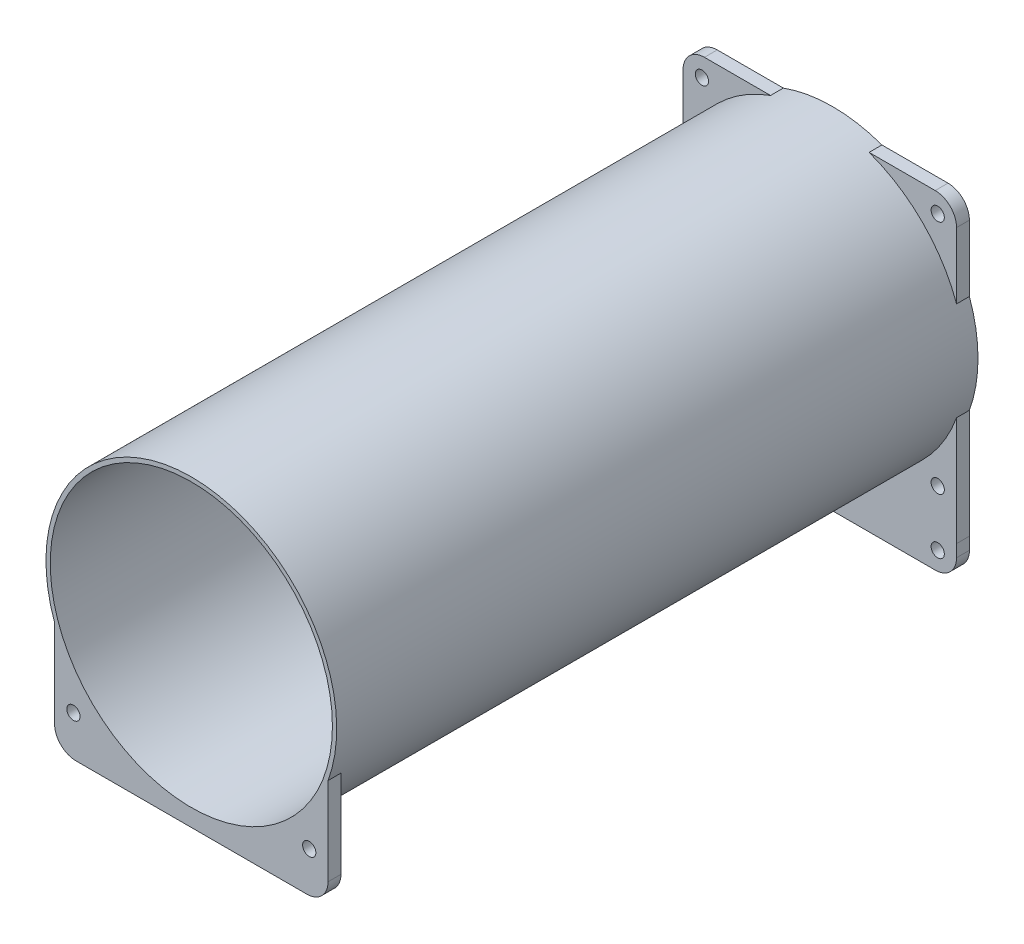
from build123d import *

# Parameters (mm, degrees)
SKETCH_2_R            = 1.5499999999999978
SKETCH_2_R_2          = 1.5500000000187404
SKETCH_2_R_3          = 33.000000000018005
SKETCH_2_R_4          = 1.5500000000180028
EXTRUDE_1_DEPTH       = 3
EXTRUDE_START         = 3
EXTRUDE_2_OUTLINE_R   = 34
EXTRUDE_2_OUTLINE_R_2 = 33
EXTRUDE_2_DEPTH       = 147
EXTRUDE_START_2       = -3
SKETCH_5_R            = 1.5499999999999978
SKETCH_5_R_2          = 1.5500000000187402
EXTRUDE_3_DEPTH       = 3


# Read off the part's stored shape, not the designer's step: 凸台-拉伸2
with BuildPart() as part:
    # 草图2 → 凸台-拉伸1 (new body)
    with BuildSketch(Plane.XY.offset(50)):
        with BuildLine():
            Line((-31.98646774923986, 34.973103667177796), (-31.986467749238788, 9.470000000000049))
            Line((-31.986467749238788, 9.47000000000005), (-31.99138785319973, 6.608597351179577))
            ThreePointArc((-31.99138785319973, 6.608597351179577), (-30.529967467729293, 3.0675070244866425), (-26.991395244649887, 1.5999999999999854))
            Line((-26.991395244649887, 1.5999999999999854), (26.99139524464973, 1.6000000000000048))
            ThreePointArc((26.99139524464973, 1.600000000000005), (30.529967467729193, 3.067507024486723), (31.99138785319957, 6.6085973511797595))
            Line((31.99138785319957, 6.6085973511797595), (31.98646774923853, 9.470000000001768))
            Line((31.98646774923853, 9.470000000001768), (31.986467749238717, 34.9731036671784))
            ThreePointArc((31.986467749239328, 34.97310366717818), (34.000000000018005, 46.499849995960744), (31.986467749239164, 58.026596324743274))
            Line((31.986467749238994, 58.02659632474322), (31.98646774923853, 73.4863177451979))
            ThreePointArc((31.986467749238525, 73.4863177451979), (30.52200165517117, 77.02185165113154), (26.986467749237562, 78.486317745199))
            Line((26.986467749237562, 78.486317745199), (11.526746328783656, 78.48631774519934))
            ThreePointArc((11.526746328783661, 78.48631774519934), (1.3678e-13, 80.49984999597851), (-11.5267463287834, 78.48631774519944))
            Line((-11.526746328783396, 78.48631774519944), (-26.98646774923796, 78.48631774520034))
            ThreePointArc((-26.98646774923796, 78.48631774520034), (-30.52200165517142, 77.02185165113266), (-31.98646774923918, 73.48631774519924))
            Line((-31.986467749239182, 73.48631774519924), (-31.986467749239175, 58.02659632474571))
            ThreePointArc((-31.986467749239328, 58.026596324742826), (-34.000000000018005, 46.4998499959604), (-31.986467749239267, 34.973103667178016))
        make_face()
        with Locations((-27.577164466275363, 5.922685529685147)):
            Circle(SKETCH_2_R, mode=Mode.SUBTRACT)
        with Locations((-27.577164466275352, 18.922685529685147)):
            Circle(SKETCH_2_R_2, mode=Mode.SUBTRACT)
        with Locations((27.57716446627534, 5.92268552968515)):
            Circle(SKETCH_2_R, mode=Mode.SUBTRACT)
        with Locations((27.577164466275352, 18.922685529685147)):
            Circle(SKETCH_2_R_2, mode=Mode.SUBTRACT)
        with Locations((0, 46.4998499959605)):
            Circle(SKETCH_2_R_3, mode=Mode.SUBTRACT)
        with Locations((-27.577164466275352, 74.07701446223585)):
            Circle(SKETCH_2_R_4, mode=Mode.SUBTRACT)
        with Locations((27.577164466275352, 74.07701446223585)):
            Circle(SKETCH_2_R_4, mode=Mode.SUBTRACT)
    extrude(amount=EXTRUDE_1_DEPTH)

    # 凸台-拉伸2 outline → 凸台-拉伸2 (add)
    with BuildSketch(Plane.XY.offset(50).offset(EXTRUDE_START)):
        with Locations((0, 46.499849996)):
            Circle(EXTRUDE_2_OUTLINE_R)
        with Locations((0, 46.499849996)):
            Circle(EXTRUDE_2_OUTLINE_R_2, mode=Mode.SUBTRACT)
    extrude(amount=EXTRUDE_2_DEPTH)

    # 草图5 → 凸台-拉伸3 (add)
    # profile 1 of 3: a face of its own
    with BuildSketch(Plane.XY.offset(200).offset(EXTRUDE_START_2)):
        with Locations((27.57716446627534, 5.92268552968515)):
            Circle(SKETCH_5_R)
    # profile 2 of 3: a face of its own
    with BuildSketch(Plane.XY.offset(200).offset(EXTRUDE_START_2)):
        with Locations((-27.577164466275363, 5.922685529685147)):
            Circle(SKETCH_5_R)
    # profile 3 of 3: a face of its own
    with BuildSketch(Plane.XY.offset(200).offset(EXTRUDE_START_2)):
        with BuildLine():
            Line((31.986467749238557, 14.470000000001733), (31.986467749238717, 34.9731036671784))
            ThreePointArc((31.986467749238717, 34.9731036671784), (6.9664e-13, 12.499849995942498), (-31.98646774923986, 34.973103667177796))
            Line((-31.98646774923986, 34.973103667177796), (-31.986467749238994, 14.470000000001559))
            ThreePointArc((-31.986467749238994, 14.470000000001559), (-30.522001655171657, 10.934466094068965), (-26.986467749239004, 9.470000000001766))
            Line((-26.986467749239004, 9.470000000001766), (26.986467749238557, 9.470000000001766))
            ThreePointArc((26.986467749238557, 9.470000000001766), (30.52200165517128, 10.93446609406902), (31.986467749238557, 14.470000000001733))
        make_face()
        with Locations((27.577164466275352, 18.922685529685147)):
            Circle(SKETCH_5_R_2, mode=Mode.SUBTRACT)
        with Locations((-27.577164466275352, 18.922685529685147)):
            Circle(SKETCH_5_R_2, mode=Mode.SUBTRACT)
    extrude(amount=EXTRUDE_3_DEPTH)


with BuildPart() as extrude_3_kept_piece:
    # of the separate pieces the step leaves, the one the design keeps (extrude_3_pieces_kept)
    add(part.part.solids().sort_by_distance((-31.986467749, 58.026596325, 50))[0])


solid = extrude_3_kept_piece.part
